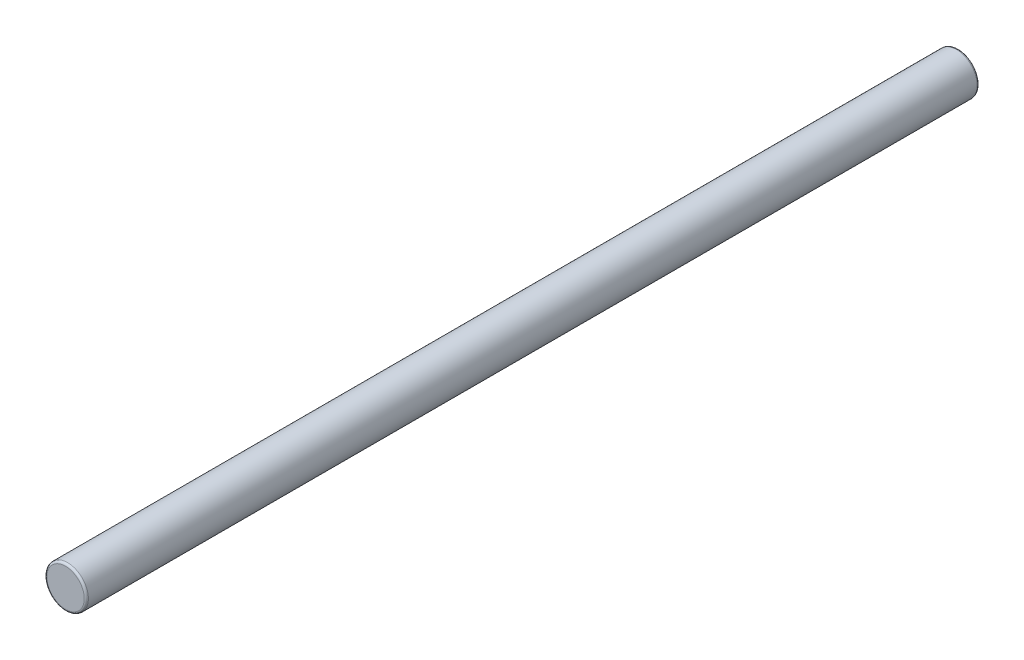
from build123d import *
from build123d.topology import SkipClean

# Parameters (mm, degrees)
SKETCH1_R                = 0.5
BOSS_EXTRUDE1_DEPTH      = 2
SKETCH2_R                = 0.75
BOSS_EXTRUDE2_DEPTH      = 8
BOSS_EXTRUDE3_START      = 8
SKETCH3_R                = 0.75
BOSS_EXTRUDE3_DEPTH      = 8
BOSS_EXTRUDE4_DEPTH      = 2
BOSS_EXTRUDE4_DEPTH_BACK = 24
SKETCH4_R                = 0.5
SKETCH5_R                = 1.083179326
SKETCH5_R_2              = 0.5
CUT_EXTRUDE1_DEPTH       = 20
SKETCH6_R                = 0.993083776
CUT_EXTRUDE2_DEPTH       = 4.5
FILLET1_R                = 0.05


with BuildPart() as part:
    # Sketch1 → Boss-Extrude1 (new, symmetric)
    with BuildSketch(Plane.XY):
        Circle(SKETCH1_R)
    extrude(amount=BOSS_EXTRUDE1_DEPTH, both=True)

    # Sketch2 → Boss-Extrude2 (add)
    with BuildSketch(Plane.XY.offset(2)):
        Circle(SKETCH2_R)
    extrude(amount=BOSS_EXTRUDE2_DEPTH)

    # Sketch3 → Boss-Extrude3 (add)
    with BuildSketch(Plane(origin=(0, 0, -2), x_dir=(-1, 0, 0), z_dir=(0, 0, -1)).offset(BOSS_EXTRUDE3_START)):
        Circle(SKETCH3_R)
    extrude(amount=-BOSS_EXTRUDE3_DEPTH)

    # Sketch4 → Boss-Extrude4 (add, two sides: drawn at the far end of the back side and taken through both)
    with BuildSketch(Plane(origin=(0, 0, -10), x_dir=(-1, 0, 0), z_dir=(0, 0, -1)).offset(-BOSS_EXTRUDE4_DEPTH_BACK)):
        Circle(SKETCH4_R)
    extrude(amount=BOSS_EXTRUDE4_DEPTH + BOSS_EXTRUDE4_DEPTH_BACK)

    # Sketch5 → Cut-Extrude1 (cut, symmetric)
    with SkipClean():  # the faces are left unmerged after this step: merging them gives an invalid solid
        with BuildSketch(Plane(origin=(0, 0, 2), x_dir=(-1, 0, 0), z_dir=(0, 0, -1))):
            Circle(SKETCH5_R)
            Circle(SKETCH5_R_2, mode=Mode.SUBTRACT)
        extrude(amount=CUT_EXTRUDE1_DEPTH, both=True, mode=Mode.SUBTRACT)
    add(part.part.scale(1), mode=Mode.REPLACE)  # the faces are merged on a copy

    # Sketch6 → Cut-Extrude2 (cut)
    with BuildSketch(Plane(origin=(0, 0, -12), x_dir=(-1, 0, 0), z_dir=(0, 0, -1))):
        Circle(SKETCH6_R)
    extrude(amount=-CUT_EXTRUDE2_DEPTH, mode=Mode.SUBTRACT)

    # Fillet1
    fillet1_edges = [part.edges().sort_by_distance(p)[0] for p in [
        (0.5, 0, 14),
        (0.5, 0, -7.5),
    ]]
    fillet(fillet1_edges, radius=FILLET1_R)


solid = part.part
